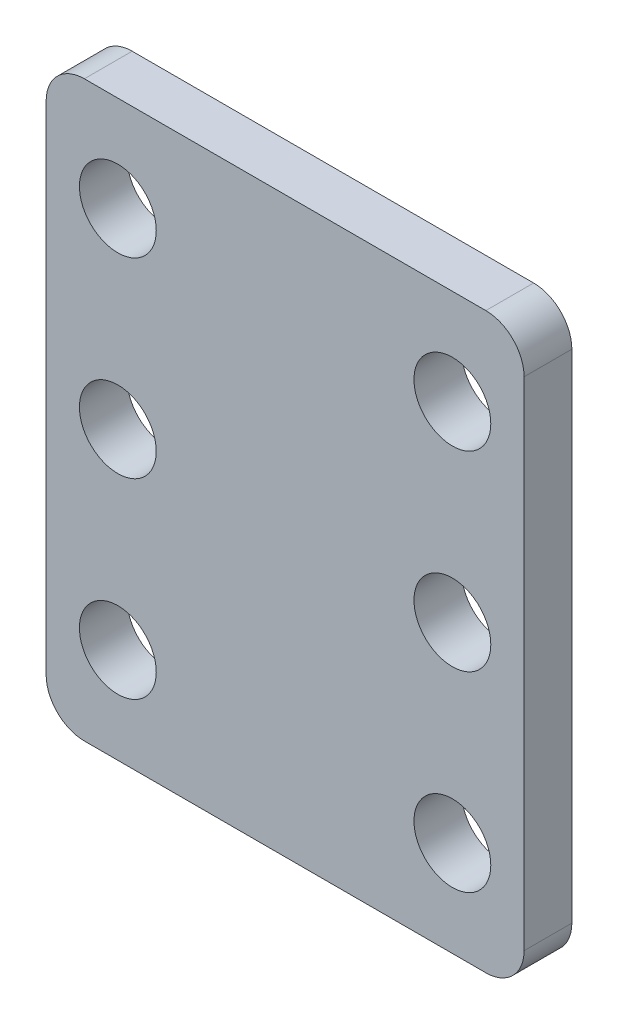
from build123d import *

# Parameters (mm, degrees)
SKETCH1_W           = 31.75
SKETCH1_H           = 38.1
SKETCH1_R           = 2.5527
BOSS_EXTRUDE1_DEPTH = 3.175
FILLET1_R           = 2.54


with BuildPart() as part:
    # Sketch1 → Boss-Extrude1 (new body)
    with BuildSketch(Plane.XY):
        Rectangle(SKETCH1_W, SKETCH1_H)
        with Locations((-11.1125, 12.7)):
            Circle(SKETCH1_R, mode=Mode.SUBTRACT)
        with Locations((-11.1125, 0)):
            Circle(SKETCH1_R, mode=Mode.SUBTRACT)
        with Locations((11.1125, 12.7)):
            Circle(SKETCH1_R, mode=Mode.SUBTRACT)
        with Locations((11.1125, -12.7)):
            Circle(SKETCH1_R, mode=Mode.SUBTRACT)
        with Locations((11.1125, 0)):
            Circle(SKETCH1_R, mode=Mode.SUBTRACT)
        with Locations((-11.1125, -12.7)):
            Circle(SKETCH1_R, mode=Mode.SUBTRACT)
    extrude(amount=BOSS_EXTRUDE1_DEPTH)

    # Fillet1
    fillet1_edges = [part.edges().sort_by_distance(p)[0] for p in [
        (-15.875, 19.05, 1.5875),
        (-15.875, -19.05, 1.5875),
        (15.875, -19.05, 1.5875),
        (15.875, 19.05, 1.5875),
    ]]
    fillet(fillet1_edges, radius=FILLET1_R)


solid = part.part
